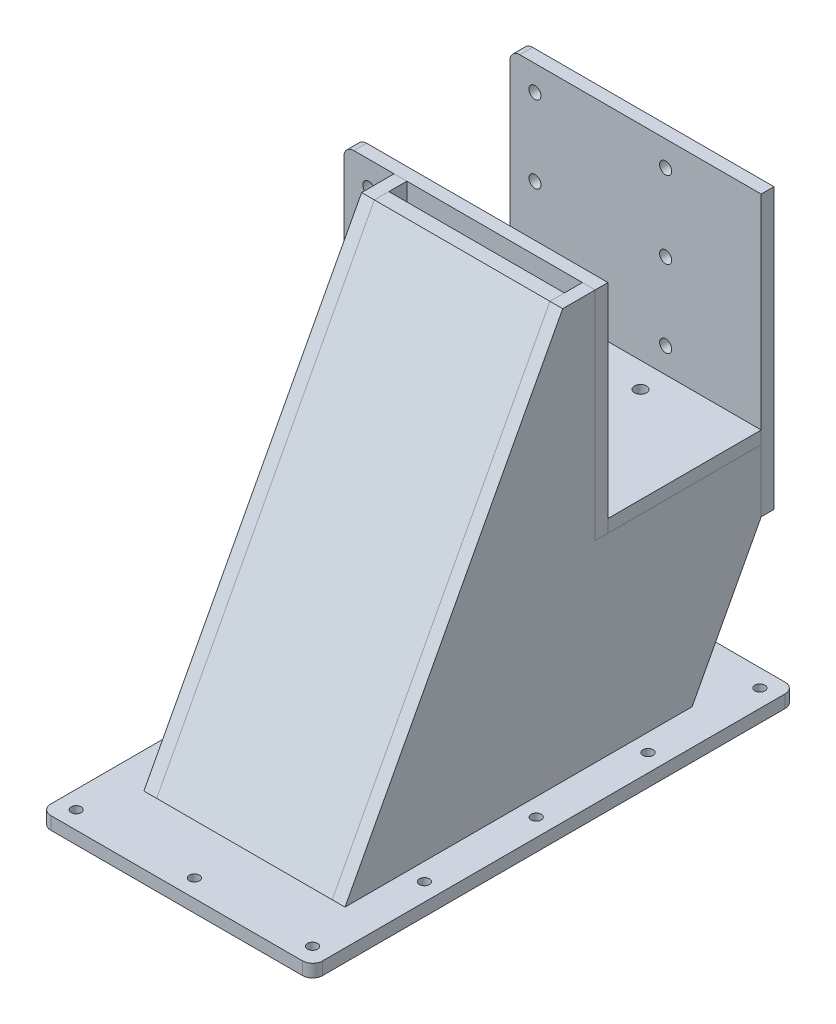
from build123d import *

# Parameters (mm, degrees)
BOSS_EXTRUDE1_DEPTH     = 50
SHELL1_T                = -6.35
BOSS_EXTRUDE2_DEPTH     = 25
SKETCH4_W               = 135.15
SKETCH4_H               = 240
BOSS_EXTRUDE3_DEPTH     = 6.35
SKETCH7_W               = 41.026455608
SKETCH7_H               = 145.876455608
CUT_EXTRUDE3_DEPTH      = 10
FILLET1_R               = 5
SKETCH5_R               = 2.5
CUT_EXTRUDE2_DEPTH      = 10
CUT_EXTRUDE4_DEPTH      = 269.467686741
CUT_EXTRUDE4_DEPTH_BACK = 269.467686741
SKETCH8_R               = 3
SKETCH16_W              = 125
SKETCH16_H              = 22.5
CUT_EXTRUDE5_DEPTH      = 260.944389575
SKETCH17_R              = 3
BOSS_EXTRUDE4_DEPTH     = 6.35
CUT_EXTRUDE6_START      = -88.9
SKETCH18_R              = 3
CUT_EXTRUDE6_DEPTH      = 88.9
SKETCH20_R              = 3
CUT_EXTRUDE7_DEPTH      = 6.35
FILLET2_R               = 5
SPLIT1_SURFACE_1_BACK   = 355.144
SPLIT1_SURFACE_1_DEPTH  = 710.288
SPLIT1_SURFACE_2_BACK   = 355.144
SPLIT1_SURFACE_2_DEPTH  = 710.288
SPLIT2_SURFACE_3_BACK   = 355.144
SPLIT2_SURFACE_3_DEPTH  = 710.288
SPLIT2_SURFACE_4_BACK   = 355.144
SPLIT2_SURFACE_4_DEPTH  = 710.288
SPLIT6_SURFACE_5_BACK   = 355.144
SPLIT6_SURFACE_5_DEPTH  = 710.288
SPLIT6_SURFACE_6_BACK   = 355.144
SPLIT6_SURFACE_6_DEPTH  = 710.288
SPLIT4_SURFACE_7_BACK   = 355.144
SPLIT4_SURFACE_7_DEPTH  = 710.288
SPLIT4_SURFACE_8_BACK   = 355.144
SPLIT4_SURFACE_8_DEPTH  = 710.288


# Read off the part's stored shape, not the designer's step: Body-Delete/Keep 2
with BuildPart() as part:
    # Sketch1 → Boss-Extrude1 (new, symmetric)
    with BuildSketch(Plane(origin=(0, 0, 0), x_dir=(0, 0, -1), z_dir=(1, 0, 0))):
        Polygon((86.301837863, 0), (-86.301837863, 0), (21.954202424, 203.6), (44.454202424, 203.6), (44.454202424, 102), (120.654202424, 102), (120.654202424, 203.6), (143.154202424, 203.6), (143.154202424, 106.923746648), align=None)
    extrude(amount=BOSS_EXTRUDE1_DEPTH, both=True)

    # Shell1
    shell1_openings = [part.faces().sort_by_distance(p)[0] for p in [
        (0, 0, 0),
        (0, 203.6, -33.204202424),
        (0, 203.6, -131.904202424),
    ]]
    offset(amount=SHELL1_T, openings=shell1_openings, kind=Kind.INTERSECTION)

    # Sketch3 → Boss-Extrude2 (add)
    with BuildSketch(Plane(origin=(50, 0, 0), x_dir=(0, 0, -1), z_dir=(1, 0, 0))):
        Polygon((44.454202424, 203.6), (38.104202424, 203.6), (38.104202424, 95.65), (69.854202424, 95.65), (69.854202424, 102), (44.454202424, 102), align=None)
        Polygon((120.654202424, 203.6), (127.004202424, 203.6), (127.004202424, 95.65), (95.254202424, 95.65), (95.254202424, 102), (120.654202424, 102), align=None)
    extrude(amount=BOSS_EXTRUDE2_DEPTH)

    # Sketch4 → Boss-Extrude3 (add)
    with BuildSketch(Plane.XZ):
        Rectangle(SKETCH4_W, SKETCH4_H)
    extrude(amount=BOSS_EXTRUDE3_DEPTH)

    # Sketch7 → Cut-Extrude3 (cut)
    with BuildSketch(Plane.XZ.offset(6.35)):
        Rectangle(SKETCH7_W, SKETCH7_H)
    extrude(amount=-CUT_EXTRUDE3_DEPTH, mode=Mode.SUBTRACT)

    # Fillet1
    fillet1_edges = [part.edges().sort_by_distance(p)[0] for p in [
        (-20.513227804, -3.175, -72.938227804),
        (-20.513227804, -3.175, 72.938227804),
        (20.513227804, -3.175, 72.938227804),
        (20.513227804, -3.175, -72.938227804),
        (75, 203.6, -41.279202424),
        (75, 203.6, -123.829202424),
        (-67.575, -3.175, 120),
        (-67.575, -3.175, -120),
        (67.575, -3.175, -120),
        (67.575, -3.175, 120),
    ]]
    fillet(fillet1_edges, radius=FILLET1_R)

    # Sketch5 → Cut-Extrude2 (cut)
    with BuildSketch(Plane(origin=(0, 0, 0), x_dir=(1, 0, 0), z_dir=(0, 1, 0))):
        with Locations(Location((-58.785, -111.21, 0), (0, 0, 270))):
            Circle(SKETCH5_R)
        with Locations(Location((0, -111.21, 0), (0, 0, 270))):
            Circle(SKETCH5_R)
        with Locations(Location((58.785, -111.21, 0), (0, 0, 270))):
            Circle(SKETCH5_R)
        with Locations(Location((58.785, -55.605, 0), (0, 0, 270))):
            Circle(SKETCH5_R)
        with Locations(Location((-58.785, -55.605, 0), (0, 0, 270))):
            Circle(SKETCH5_R)
        with Locations(Location((-58.785, 0, 0), (0, 0, 270))):
            Circle(SKETCH5_R)
        with Locations(Location((58.785, 0, 0), (0, 0, 270))):
            Circle(SKETCH5_R)
        with Locations(Location((58.785, 55.605, 0), (0, 0, 270))):
            Circle(SKETCH5_R)
        with Locations(Location((-58.785, 55.605, 0), (0, 0, 270))):
            Circle(SKETCH5_R)
        with Locations(Location((-58.785, 111.21, 0), (0, 0, 270))):
            Circle(SKETCH5_R)
        with Locations(Location((58.785, 111.21, 0), (0, 0, 270))):
            Circle(SKETCH5_R)
    extrude(amount=-CUT_EXTRUDE2_DEPTH, mode=Mode.SUBTRACT)

    # Sketch8 → Cut-Extrude4 (cut, two sides: drawn at the far end of the back side and taken through both)
    with BuildSketch(Plane.XY.offset(-38.104202424).offset(-CUT_EXTRUDE4_DEPTH_BACK)):
        with Locations(Location((62.5, 152.8, 0), (0, 0, 270))):
            Circle(SKETCH8_R)
        with Locations(Location((62.5, 191.1, 0), (0, 0, 270))):
            Circle(SKETCH8_R)
        with Locations(Location((62.5, 114.5, 0), (0, 0, 270))):
            Circle(SKETCH8_R)
    extrude(amount=CUT_EXTRUDE4_DEPTH + CUT_EXTRUDE4_DEPTH_BACK, mode=Mode.SUBTRACT)

    # Sketch16 → Cut-Extrude5 (cut, through all)
    with BuildSketch(Plane(origin=(0, 0, 0), x_dir=(1, 0, 0), z_dir=(0, 1, 0))):
        with Locations((12.5, 131.904202424)):
            Rectangle(SKETCH16_W, SKETCH16_H)
    extrude(amount=CUT_EXTRUDE5_DEPTH, mode=Mode.SUBTRACT)


with BuildPart() as body_2:
    # Sketch17 → Boss-Extrude4 (new body)
    with BuildSketch(Plane(origin=(0, 0, -120.654202424), x_dir=(-1, 0, 0), z_dir=(0, 0, -1))):
        with BuildLine():
            Line((50, 203.6), (50, 64.607401178))
            Line((50, 64.607401178), (-50, 64.607401178))
            Line((-50, 64.607401178), (-50, 95.65))
            Line((-50, 95.65), (-75, 95.65))
            Line((-75, 95.65), (-75, 198.6))
            ThreePointArc((-75, 198.6), (-73.535533906, 202.135533906), (-70, 203.6))
            Line((-70, 203.6), (50, 203.6))
        make_face()
        with Locations(Location((-62.5, 114.5, 0), (0, 0, 90))):
            Circle(SKETCH17_R, mode=Mode.SUBTRACT)
        with Locations(Location((-62.5, 152.8, 0), (0, 0, 90))):
            Circle(SKETCH17_R, mode=Mode.SUBTRACT)
        with Locations(Location((-62.5, 191.1, 0), (0, 0, 90))):
            Circle(SKETCH17_R, mode=Mode.SUBTRACT)
    extrude(amount=BOSS_EXTRUDE4_DEPTH)


with BuildPart() as cut_extrude6_tool:
    # Sketch18 → Cut-Extrude6 (new body)
    with BuildSketch(Plane(origin=(0, 0, -127.004202424), x_dir=(-1, 0, 0), z_dir=(0, 0, -1)).offset(CUT_EXTRUDE6_START)):
        with Locations(Location((2.5, 191.1, 0), (0, 0, 90))):
            Circle(SKETCH18_R)
        with Locations(Location((2.5, 152.8, 0), (0, 0, 90))):
            Circle(SKETCH18_R)
        with Locations(Location((2.5, 114.5, 0), (0, 0, 90))):
            Circle(SKETCH18_R)
    extrude(amount=CUT_EXTRUDE6_DEPTH)


with BuildPart() as part_1:
    add(part.part)

    # Cut-Extrude6: cut by cut_extrude6_tool
    add(cut_extrude6_tool.part, mode=Mode.SUBTRACT)

    # Sketch20 → Cut-Extrude7 (cut)
    with BuildSketch(Plane(origin=(0, 102, 0), x_dir=(1, 0, 0), z_dir=(0, 1, 0))):
        with Locations(Location((62.5, 108.154202424, 0), (0, 0, 270))):
            Circle(SKETCH20_R)
        with Locations(Location((62.5, 56.954202424, 0), (0, 0, 270))):
            Circle(SKETCH20_R)
        with Locations(Location((-2.5, 56.954202424, 0), (0, 0, 270))):
            Circle(SKETCH20_R)
        with Locations(Location((-2.5, 108.154202424, 0), (0, 0, 270))):
            Circle(SKETCH20_R)
    extrude(amount=-CUT_EXTRUDE7_DEPTH, mode=Mode.SUBTRACT)

    # Fillet2
    fillet2_edges = [part_1.edges().sort_by_distance(p)[0] for p in [
        (50, 98.825, -69.854202424),
        (75, 98.825, -69.854202424),
        (50, 98.825, -95.254202424),
        (75, 98.825, -95.254202424),
    ]]
    fillet(fillet2_edges, radius=FILLET2_R)


with BuildPart() as body_2_1:
    add(body_2.part)

    # Cut-Extrude6: cut by cut_extrude6_tool
    add(cut_extrude6_tool.part, mode=Mode.SUBTRACT)


with BuildPart() as body_3:
    # Split1: the piece behind the surface
    add(part_1.part)
    # Split1 surface: a surface, the sketch's curves swept straight by 710.288 mm
    with BuildLine(Plane.XY.offset(120).offset(-SPLIT1_SURFACE_1_BACK), mode=Mode.PRIVATE) as split1_surface_1_path:
        Line((-62.575, 0), (62.575, 0))
    split1_surface_1 = Shell.extrude(split1_surface_1_path.wire(), (0 * SPLIT1_SURFACE_1_DEPTH, 0 * SPLIT1_SURFACE_1_DEPTH, 1 * SPLIT1_SURFACE_1_DEPTH))
    split(bisect_by=split1_surface_1, keep=Keep.BOTTOM)


with BuildPart() as part_2:
    add(part_1.part)

    # Split1: split by a surface, the side it looks to stays
    # Split1 surface: a surface, the sketch's curves swept straight by 710.288 mm
    with BuildLine(Plane.XY.offset(120).offset(-SPLIT1_SURFACE_2_BACK), mode=Mode.PRIVATE) as split1_surface_2_path:
        Line((-62.575, 0), (62.575, 0))
    split1_surface_2 = Shell.extrude(split1_surface_2_path.wire(), (0 * SPLIT1_SURFACE_2_DEPTH, 0 * SPLIT1_SURFACE_2_DEPTH, 1 * SPLIT1_SURFACE_2_DEPTH))
    split(bisect_by=split1_surface_2, keep=Keep.TOP)


with BuildPart() as body_4:
    # Split2: the piece behind the surface
    add(part_2.part)
    # Split2 surface: a surface, the sketch's curves swept straight by 710.288 mm
    with BuildLine(Plane(origin=(75, 0, 0), x_dir=(0, 0, -1), z_dir=(1, 0, 0)).offset(-SPLIT2_SURFACE_3_BACK), mode=Mode.PRIVATE) as split2_surface_3_path:
        Line((44.454202424, 102), (120.654202424, 102))
        Line((120.654202424, 102), (120.654202424, 95.65))
        Line((120.654202424, 95.65), (44.454202424, 95.65))
        Line((44.454202424, 95.65), (44.454202424, 102))
    split2_surface_3 = Shell.extrude(split2_surface_3_path.wire(), (1 * SPLIT2_SURFACE_3_DEPTH, 0 * SPLIT2_SURFACE_3_DEPTH, 0 * SPLIT2_SURFACE_3_DEPTH))
    split(bisect_by=split2_surface_3, keep=Keep.BOTTOM)


with BuildPart() as part_3:
    add(part_2.part)

    # Split2: split by a surface, the side it looks to stays
    # Split2 surface: a surface, the sketch's curves swept straight by 710.288 mm
    with BuildLine(Plane(origin=(75, 0, 0), x_dir=(0, 0, -1), z_dir=(1, 0, 0)).offset(-SPLIT2_SURFACE_4_BACK), mode=Mode.PRIVATE) as split2_surface_4_path:
        Line((44.454202424, 102), (120.654202424, 102))
        Line((120.654202424, 102), (120.654202424, 95.65))
        Line((120.654202424, 95.65), (44.454202424, 95.65))
        Line((44.454202424, 95.65), (44.454202424, 102))
    split2_surface_4 = Shell.extrude(split2_surface_4_path.wire(), (1 * SPLIT2_SURFACE_4_DEPTH, 0 * SPLIT2_SURFACE_4_DEPTH, 0 * SPLIT2_SURFACE_4_DEPTH))
    split(bisect_by=split2_surface_4, keep=Keep.TOP)


with BuildPart() as body_5:
    # Split6: the piece behind the surface
    add(part_3.part)
    # Split6 surface: a surface, the sketch's curves swept straight by 710.288 mm
    with BuildLine(Plane(origin=(50, 0, 0), x_dir=(0, 0, -1), z_dir=(1, 0, 0)).offset(-SPLIT6_SURFACE_5_BACK), mode=Mode.PRIVATE) as split6_surface_5_path:
        Line((44.454202424, 203.6), (38.104202424, 203.6))
        Line((38.104202424, 203.6), (38.104202424, 95.65))
        Line((38.104202424, 95.65), (44.454202424, 95.65))
        Line((44.454202424, 95.65), (44.454202424, 203.6))
    split6_surface_5 = Shell.extrude(split6_surface_5_path.wire(), (1 * SPLIT6_SURFACE_5_DEPTH, 0 * SPLIT6_SURFACE_5_DEPTH, 0 * SPLIT6_SURFACE_5_DEPTH))
    split(bisect_by=split6_surface_5, keep=Keep.BOTTOM)


with BuildPart() as part_4:
    add(part_3.part)

    # Split6: split by a surface, the side it looks to stays
    # Split6 surface: a surface, the sketch's curves swept straight by 710.288 mm
    with BuildLine(Plane(origin=(50, 0, 0), x_dir=(0, 0, -1), z_dir=(1, 0, 0)).offset(-SPLIT6_SURFACE_6_BACK), mode=Mode.PRIVATE) as split6_surface_6_path:
        Line((44.454202424, 203.6), (38.104202424, 203.6))
        Line((38.104202424, 203.6), (38.104202424, 95.65))
        Line((38.104202424, 95.65), (44.454202424, 95.65))
        Line((44.454202424, 95.65), (44.454202424, 203.6))
    split6_surface_6 = Shell.extrude(split6_surface_6_path.wire(), (1 * SPLIT6_SURFACE_6_DEPTH, 0 * SPLIT6_SURFACE_6_DEPTH, 0 * SPLIT6_SURFACE_6_DEPTH))
    split(bisect_by=split6_surface_6, keep=Keep.TOP)


with BuildPart() as body_6:
    # Split4: the piece behind the surface
    add(body_5.part)
    # Split4 surface: a surface, the sketch's curves swept straight by 710.288 mm
    with BuildLine(Plane(origin=(0, 203.6, 0), x_dir=(1, 0, 0), z_dir=(0, 1, 0)).offset(-SPLIT4_SURFACE_7_BACK), mode=Mode.PRIVATE) as split4_surface_7_path:
        Line((-43.65, 127.004202424), (43.65, 127.004202424))
        Line((43.65, 127.004202424), (43.65, -120))
        Line((43.65, -120), (-43.65, -120))
        Line((-43.65, -120), (-43.65, 127.004202424))
    split4_surface_7 = Shell.extrude(split4_surface_7_path.wire(), (0 * SPLIT4_SURFACE_7_DEPTH, 1 * SPLIT4_SURFACE_7_DEPTH, 0 * SPLIT4_SURFACE_7_DEPTH))
    split(bisect_by=split4_surface_7, keep=Keep.BOTTOM)


with BuildPart() as body_5_1:
    add(body_5.part)

    # Split4: split by a surface, the side it looks to stays
    # Split4 surface: a surface, the sketch's curves swept straight by 710.288 mm
    with BuildLine(Plane(origin=(0, 203.6, 0), x_dir=(1, 0, 0), z_dir=(0, 1, 0)).offset(-SPLIT4_SURFACE_8_BACK), mode=Mode.PRIVATE) as split4_surface_8_path:
        Line((-43.65, 127.004202424), (43.65, 127.004202424))
        Line((43.65, 127.004202424), (43.65, -120))
        Line((43.65, -120), (-43.65, -120))
        Line((-43.65, -120), (-43.65, 127.004202424))
    split4_surface_8 = Shell.extrude(split4_surface_8_path.wire(), (0 * SPLIT4_SURFACE_8_DEPTH, 1 * SPLIT4_SURFACE_8_DEPTH, 0 * SPLIT4_SURFACE_8_DEPTH))
    split(bisect_by=split4_surface_8, keep=Keep.TOP)


with BuildPart() as body_7:
    # Mirror1: mirrored copy
    add(part_4.part.mirror(Plane(origin=(0, 0, 0), x_dir=(0, 0, 1), z_dir=(1, 0, 0))))


with BuildPart() as body_8:
    # Mirror1 2: mirrored copy
    add(body_2_1.part.mirror(Plane(origin=(0, 0, 0), x_dir=(0, 0, 1), z_dir=(1, 0, 0))))


with BuildPart() as body_9:
    # Mirror1 3: mirrored copy
    add(body_3.part.mirror(Plane(origin=(0, 0, 0), x_dir=(0, 0, 1), z_dir=(1, 0, 0))))


with BuildPart() as body_10:
    # Mirror1 4: mirrored copy
    add(body_4.part.mirror(Plane(origin=(0, 0, 0), x_dir=(0, 0, 1), z_dir=(1, 0, 0))))


with BuildPart() as body_11:
    # Mirror1 5: mirrored copy
    add(body_5_1.part.mirror(Plane(origin=(0, 0, 0), x_dir=(0, 0, 1), z_dir=(1, 0, 0))))


with BuildPart() as body_12:
    # Mirror1 6: mirrored copy
    add(body_6.part.mirror(Plane(origin=(0, 0, 0), x_dir=(0, 0, 1), z_dir=(1, 0, 0))))


solid = Compound([body_7.part, body_8.part, body_9.part, body_10.part, body_11.part, body_12.part])
